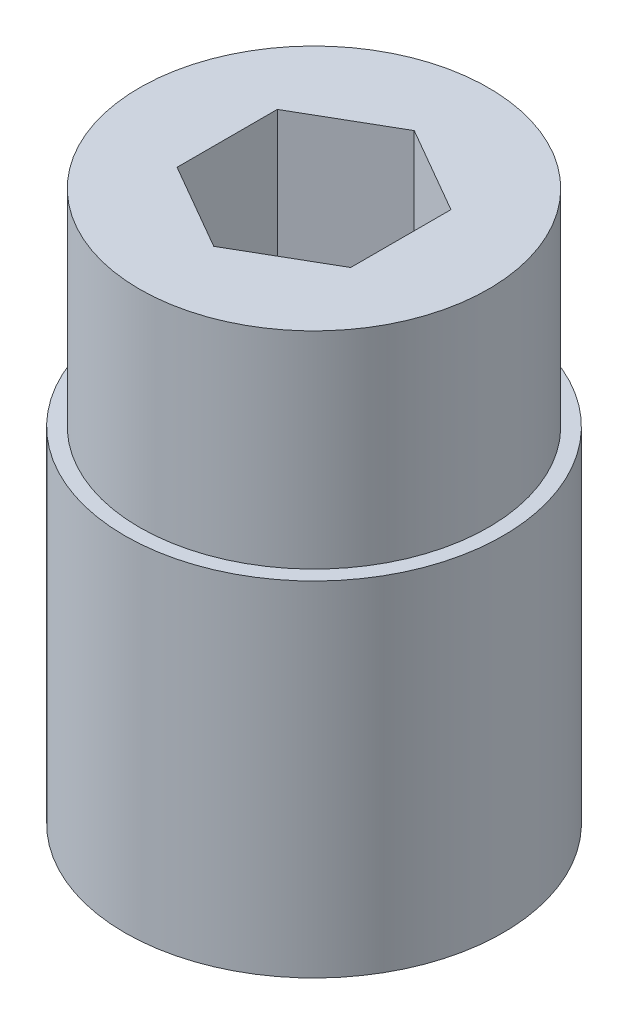
from build123d import *

# Parameters (mm, degrees)
SKETCH1_R           = 7
BOSS_EXTRUDE1_DEPTH = 10
SKETCH2_R           = 5.075
BOSS_EXTRUDE2_DEPTH = 6
CUT_EXTRUDE2_DEPTH  = 19.814887722
SKETCH5_OUTSIDE_W   = 21.092
SKETCH5_OUTSIDE_H   = 21.092
SKETCH5_OUTSIDE_R   = 5.5
CUT_EXTRUDE3_DEPTH  = 15.071247279


with BuildPart() as part:
    # Sketch1 → Boss-Extrude1 (new body)
    with BuildSketch(Plane(origin=(0, 0, 0), x_dir=(1, 0, 0), z_dir=(0, 1, 0))):
        Circle(SKETCH1_R)
    extrude(amount=BOSS_EXTRUDE1_DEPTH)

    # Sketch2 → Boss-Extrude2 (add)
    with BuildSketch(Plane(origin=(0, 10, 0), x_dir=(1, 0, 0), z_dir=(0, 1, 0))):
        Circle(SKETCH2_R)
    extrude(amount=BOSS_EXTRUDE2_DEPTH)

    # Sketch4 → Cut-Extrude2 (cut, through all)
    with BuildSketch(Plane(origin=(0, 16, 0), x_dir=(1, 0, 0), z_dir=(0, 1, 0))):
        Polygon((2.525, 1.45780943), (0, 2.915618859), (-2.525, 1.45780943), (-2.525, -1.45780943), (0, -2.915618859), (2.525, -1.45780943), align=None)
    extrude(amount=-CUT_EXTRUDE2_DEPTH, mode=Mode.SUBTRACT)

    # Sketch5 outside → Cut-Extrude3 (cut, through all)
    with BuildSketch(Plane(origin=(0, 10, 0), x_dir=(1, 0, 0), z_dir=(0, 1, 0))):
        Rectangle(SKETCH5_OUTSIDE_W, SKETCH5_OUTSIDE_H)
        Circle(SKETCH5_OUTSIDE_R, mode=Mode.SUBTRACT)
    extrude(amount=-CUT_EXTRUDE3_DEPTH, mode=Mode.SUBTRACT)


solid = part.part
